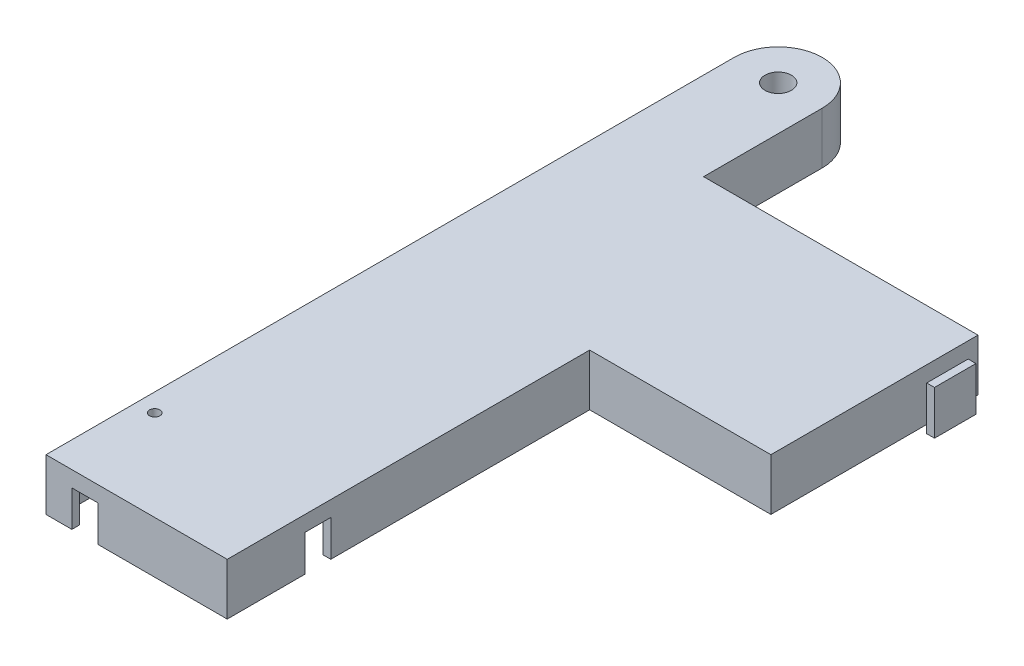
from build123d import *

# Parameters (mm, degrees)
CORNERBOSS_EXTRUDE1_DEPTH               = 20
SHELL2_T                                = -3
PADSKETCH3_R                            = 12
PADSKETCH3_R_2                          = 5
PADBOSS_EXTRUDE2_DEPTH                  = 10
STEPPERSHAFTHOLESKETCH4_R               = 5.1
STEPPERSHAFTHOLESKETCH4_R_2             = 2
STEPPERSHAFTCUT_EXTRUDE2_DEPTH          = 316.846451025
THREADEDNUTMOUNTHOLESSKETCH5_R          = 1
THREADEDNUTMOUNTHOLESCUT_EXTRUDE4_DEPTH = 10
TRPEGSKETCH1_W                          = 9.8
TRPEGSKETCH1_H                          = 13.9
TRPEGBOSS_EXTRUDE1_DEPTH                = 3.1
TRPEGCAPSKETCH2_W                       = 16
TRPEGCAPSKETCH2_H                       = 17
TRPEGCAPBOSS_EXTRUDE2_DEPTH             = 3
BOTTOMPEGHOLESKETCH3_W                  = 10
BOTTOMPEGHOLESKETCH3_H                  = 13.9
BOTTOMPEGHOLECUT_EXTRUDE1_DEPTH         = 3
BEDCENTERPEGHOLECUTSKETCH1_W            = 10
BEDCENTERPEGHOLECUTSKETCH1_H            = 14
BEDCENTERPEGHOLECUT_EXTRUDE1_DEPTH      = 3


with BuildPart() as part:
    # CornerrSketch1 → CornerBoss-Extrude1 (new body)
    with BuildSketch(Plane(origin=(0, 0, 0), x_dir=(1, 0, 0), z_dir=(0, 1, 0))):
        with BuildLine():
            Line((140, 220), (140, 140))
            Line((140, 140), (70, 140))
            Line((70, 140), (70, 0))
            Line((70, 0), (0, 0))
            Line((0, 0), (0, 265.825))
            ThreePointArc((0, 265.825), (17, 282.825), (34, 265.825))
            Line((34, 265.825), (34, 220))
            Line((34, 220), (140, 220))
        make_face()
    extrude(amount=CORNERBOSS_EXTRUDE1_DEPTH)

    # Shell2
    shell2_openings = [part.faces().sort_by_distance(p)[0] for p in [
        (50.460788317, 0, -139.249856422),
    ]]
    offset(amount=SHELL2_T, openings=shell2_openings, kind=Kind.INTERSECTION)

    # PadSketch3 → PadBoss-Extrude2 (add)
    with BuildSketch(Plane.XZ.offset(-17)):
        with Locations((17, -265.825)):
            Circle(PADSKETCH3_R)
        with Locations((7, -35)):
            Circle(PADSKETCH3_R_2)
    extrude(amount=PADBOSS_EXTRUDE2_DEPTH)

    # StepperShaftHoleSketch4 → StepperShaftCut-Extrude2 (cut, through all)
    with BuildSketch(Plane.XZ.offset(-7)):
        with Locations((17, -265.825)):
            Circle(STEPPERSHAFTHOLESKETCH4_R)
        with Locations((7, -35)):
            Circle(STEPPERSHAFTHOLESKETCH4_R_2)
    extrude(amount=-STEPPERSHAFTCUT_EXTRUDE2_DEPTH, mode=Mode.SUBTRACT)

    # ThreadedNutMountHolesSketch5 → ThreadedNutMountHolesCut-Extrude4 (cut)
    with BuildSketch(Plane(origin=(0, 7, 0), x_dir=(-1, 0, 0), z_dir=(0, -1, 0))):
        with Locations((-17, 273.825)):
            Circle(THREADEDNUTMOUNTHOLESSKETCH5_R)
        with Locations((-9, 265.825)):
            Circle(THREADEDNUTMOUNTHOLESSKETCH5_R)
        with Locations((-17, 257.825)):
            Circle(THREADEDNUTMOUNTHOLESSKETCH5_R)
        with Locations((-25, 265.825)):
            Circle(THREADEDNUTMOUNTHOLESSKETCH5_R)
    extrude(amount=-THREADEDNUTMOUNTHOLESCUT_EXTRUDE4_DEPTH, mode=Mode.SUBTRACT)

    # TRPegSketch1 → TRPegBoss-Extrude1 (add)
    with BuildSketch(Plane(origin=(140, 0, 0), x_dir=(0, 0, -1), z_dir=(1, 0, 0))):
        with Locations((205, 6.95)):
            Rectangle(TRPEGSKETCH1_W, TRPEGSKETCH1_H)
    extrude(amount=TRPEGBOSS_EXTRUDE1_DEPTH)

    # TRPegCapSketch2 → TRPegCapBoss-Extrude2 (add)
    with BuildSketch(Plane(origin=(143.1, 0, 0), x_dir=(0, 0, -1), z_dir=(1, 0, 0))):
        with Locations((205.1, 8.5)):
            Rectangle(TRPEGCAPSKETCH2_W, TRPEGCAPSKETCH2_H)
    extrude(amount=TRPEGCAPBOSS_EXTRUDE2_DEPTH)

    # BottomPegHoleSketch3 → BottomPegHoleCut-Extrude1 (cut)
    with BuildSketch(Plane.XY):
        with Locations((15, 6.95)):
            Rectangle(BOTTOMPEGHOLESKETCH3_W, BOTTOMPEGHOLESKETCH3_H)
    extrude(amount=-BOTTOMPEGHOLECUT_EXTRUDE1_DEPTH, mode=Mode.SUBTRACT)

    # BedCenterPegHoleCutSketch1 → BedCenterPegHoleCut-Extrude1 (cut)
    with BuildSketch(Plane(origin=(70, 0, 0), x_dir=(0, 0, -1), z_dir=(1, 0, 0))):
        with Locations((35, 7)):
            Rectangle(BEDCENTERPEGHOLECUTSKETCH1_W, BEDCENTERPEGHOLECUTSKETCH1_H)
    extrude(amount=-BEDCENTERPEGHOLECUT_EXTRUDE1_DEPTH, mode=Mode.SUBTRACT)


solid = part.part
